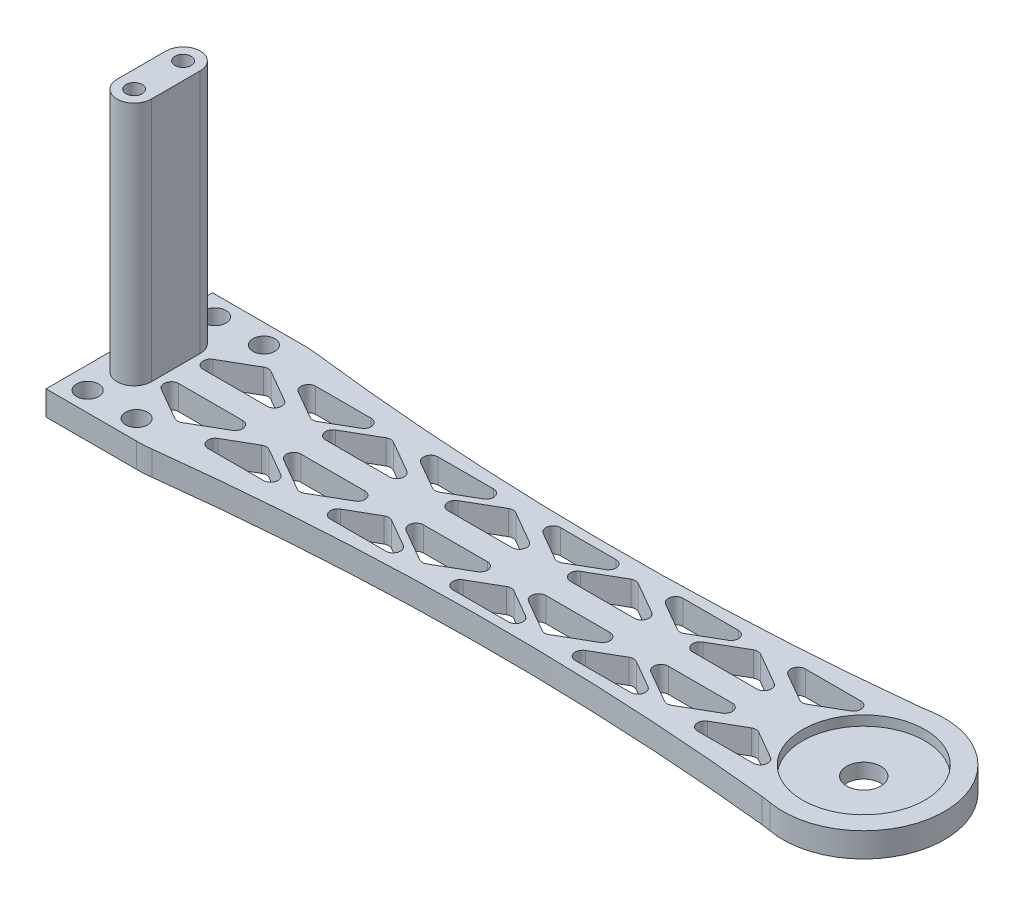
from build123d import *

# Parameters (mm, degrees)
EXTRUDE_1_DEPTH        = 2.5
SKETCH_2_R             = 12.5
CUT_EXTRUDE_1_DEPTH    = 2
SKETCH_3_R             = 3.5
CUT_EXTRUDE_2_DEPTH    = 168.392502819
CUT_EXTRUDE_3_DEPTH    = 168.440287864
CUT_EXTRUDE_4_DEPTH    = 168.440287864
SKETCH_6_R             = 2.25
CUT_EXTRUDE_5_DEPTH    = 168.440287864
FILLET_1_R             = 25
EXTRUDE_2_DEPTH        = 50
HOLE_WIZARD_M4_1_D     = 3.3
HOLE_WIZARD_M4_1_DEPTH = 11.5
HOLE_WIZARD_M4_1_TIP   = 0.991420021


with BuildPart() as part:
    # 草图1 → 凸台-拉伸1 (new, symmetric)
    with BuildSketch(Plane(origin=(0, 0, 0), x_dir=(1, 0, 0), z_dir=(0, 1, 0))):
        with BuildLine():
            Line((20, 17), (0, 17))
            Line((0, 17), (0, -17))
            Line((0, -17), (20, -17))
            ThreePointArc((20, -17), (83.152837536, -12.905656082), (146.357941984, -16.09302375))
            ThreePointArc((146.357941984, -16.09302375), (166.5, 0), (146.357941984, 16.09302375))
            ThreePointArc((146.357941984, 16.09302375), (83.152837536, 12.905656082), (20, 17))
        make_face()
    extrude(amount=EXTRUDE_1_DEPTH, both=True)

    # 草图2 → 切除-拉伸1 (cut)
    with BuildSketch(Plane(origin=(0, 2.5, 0), x_dir=(1, 0, 0), z_dir=(0, 1, 0))):
        with Locations((150, 0)):
            Circle(SKETCH_2_R)
    extrude(amount=-CUT_EXTRUDE_1_DEPTH, mode=Mode.SUBTRACT)

    # 草图3 → 切除-拉伸2 (cut, through all)
    with BuildSketch(Plane(origin=(0, 0.5, 0), x_dir=(1, 0, 0), z_dir=(0, 1, 0))):
        with Locations((150, 0)):
            Circle(SKETCH_3_R)
    extrude(amount=-CUT_EXTRUDE_2_DEPTH, mode=Mode.SUBTRACT)

    # 草图4 → 切除-拉伸3 (cut, through all)
    with BuildSketch(Plane(origin=(0, 2.5, 0), x_dir=(1, 0, 0), z_dir=(0, 1, 0))):
        with BuildLine():
            Line((12.598076211, 2.5), (25.650635095, 2.5))
            ThreePointArc((25.650635095, 2.5), (27.099523834, 3.611771432), (26.400635095, 5.299038106))
            Line((26.400635095, 5.299038106), (19.874355653, 9.066987298))
            ThreePointArc((19.874355653, 9.066987298), (19.124355653, 9.267949192), (18.374355653, 9.066987298))
            Line((18.374355653, 9.066987298), (11.848076211, 5.299038106))
            ThreePointArc((11.848076211, 5.299038106), (11.149187472, 3.611771432), (12.598076211, 2.5))
        make_face()
        with BuildLine():
            Line((37.598076211, 2.5), (50.650635095, 2.5))
            ThreePointArc((50.650635095, 2.5), (52.099523834, 3.611771432), (51.400635095, 5.299038106))
            Line((51.400635095, 5.299038106), (44.874355653, 9.066987298))
            ThreePointArc((44.874355653, 9.066987298), (44.124355653, 9.267949192), (43.374355653, 9.066987298))
            Line((43.374355653, 9.066987298), (36.848076211, 5.299038106))
            ThreePointArc((36.848076211, 5.299038106), (36.149187472, 3.611771432), (37.598076211, 2.5))
        make_face()
        with BuildLine():
            Line((62.598076211, 2.5), (75.650635095, 2.5))
            ThreePointArc((75.650635095, 2.5), (77.099523834, 3.611771432), (76.400635095, 5.299038106))
            Line((76.400635095, 5.299038106), (69.874355653, 9.066987298))
            ThreePointArc((69.874355653, 9.066987298), (69.124355653, 9.267949192), (68.374355653, 9.066987298))
            Line((68.374355653, 9.066987298), (61.848076211, 5.299038106))
            ThreePointArc((61.848076211, 5.299038106), (61.149187472, 3.611771432), (62.598076211, 2.5))
        make_face()
        with BuildLine():
            Line((87.598076211, 2.5), (100.650635095, 2.5))
            ThreePointArc((100.650635095, 2.5), (102.099523834, 3.611771432), (101.400635095, 5.299038106))
            Line((101.400635095, 5.299038106), (94.874355653, 9.066987298))
            ThreePointArc((94.874355653, 9.066987298), (94.124355653, 9.267949192), (93.374355653, 9.066987298))
            Line((93.374355653, 9.066987298), (86.848076211, 5.299038106))
            ThreePointArc((86.848076211, 5.299038106), (86.149187472, 3.611771432), (87.598076211, 2.5))
        make_face()
        with BuildLine():
            Line((112.598076211, 2.5), (125.650635095, 2.5))
            ThreePointArc((125.650635095, 2.5), (127.099523834, 3.611771432), (126.400635095, 5.299038106))
            Line((126.400635095, 5.299038106), (119.874355653, 9.066987298))
            ThreePointArc((119.874355653, 9.066987298), (119.124355653, 9.267949192), (118.374355653, 9.066987298))
            Line((118.374355653, 9.066987298), (111.848076211, 5.299038106))
            ThreePointArc((111.848076211, 5.299038106), (111.149187472, 3.611771432), (112.598076211, 2.5))
        make_face()
        with BuildLine():
            Line((118.374355653, -9.066987298), (111.848076211, -5.299038106))
            ThreePointArc((111.848076211, -5.299038106), (111.149187472, -3.611771432), (112.598076211, -2.5))
            Line((112.598076211, -2.5), (125.650635095, -2.5))
            ThreePointArc((125.650635095, -2.5), (127.099523834, -3.611771432), (126.400635095, -5.299038106))
            Line((126.400635095, -5.299038106), (119.874355653, -9.066987298))
            ThreePointArc((119.874355653, -9.066987298), (119.124355653, -9.267949192), (118.374355653, -9.066987298))
        make_face()
        with BuildLine():
            Line((93.374355653, -9.066987298), (86.848076211, -5.299038106))
            ThreePointArc((86.848076211, -5.299038106), (86.149187472, -3.611771432), (87.598076211, -2.5))
            Line((87.598076211, -2.5), (100.650635095, -2.5))
            ThreePointArc((100.650635095, -2.5), (102.099523834, -3.611771432), (101.400635095, -5.299038106))
            Line((101.400635095, -5.299038106), (94.874355653, -9.066987298))
            ThreePointArc((94.874355653, -9.066987298), (94.124355653, -9.267949192), (93.374355653, -9.066987298))
        make_face()
        with BuildLine():
            Line((68.374355653, -9.066987298), (61.848076211, -5.299038106))
            ThreePointArc((61.848076211, -5.299038106), (61.149187472, -3.611771432), (62.598076211, -2.5))
            Line((62.598076211, -2.5), (75.650635095, -2.5))
            ThreePointArc((75.650635095, -2.5), (77.099523834, -3.611771432), (76.400635095, -5.299038106))
            Line((76.400635095, -5.299038106), (69.874355653, -9.066987298))
            ThreePointArc((69.874355653, -9.066987298), (69.124355653, -9.267949192), (68.374355653, -9.066987298))
        make_face()
        with BuildLine():
            Line((43.374355653, -9.066987298), (36.848076211, -5.299038106))
            ThreePointArc((36.848076211, -5.299038106), (36.149187472, -3.611771432), (37.598076211, -2.5))
            Line((37.598076211, -2.5), (50.650635095, -2.5))
            ThreePointArc((50.650635095, -2.5), (52.099523834, -3.611771432), (51.400635095, -5.299038106))
            Line((51.400635095, -5.299038106), (44.874355653, -9.066987298))
            ThreePointArc((44.874355653, -9.066987298), (44.124355653, -9.267949192), (43.374355653, -9.066987298))
        make_face()
        with BuildLine():
            Line((18.374355653, -9.066987298), (11.848076211, -5.299038106))
            ThreePointArc((11.848076211, -5.299038106), (11.149187472, -3.611771432), (12.598076211, -2.5))
            Line((12.598076211, -2.5), (25.650635095, -2.5))
            ThreePointArc((25.650635095, -2.5), (27.099523834, -3.611771432), (26.400635095, -5.299038106))
            Line((26.400635095, -5.299038106), (19.874355653, -9.066987298))
            ThreePointArc((19.874355653, -9.066987298), (19.124355653, -9.267949192), (18.374355653, -9.066987298))
        make_face()
    extrude(amount=-CUT_EXTRUDE_3_DEPTH, mode=Mode.SUBTRACT)

    # 草图5 → 切除-拉伸4 (cut, through all)
    with BuildSketch(Plane(origin=(0, 2.5, 0), x_dir=(1, 0, 0), z_dir=(0, 1, 0))):
        with BuildLine():
            Line((127.081415713, 11), (138.401923789, 11))
            ThreePointArc((138.401923789, 11), (139.850812528, 9.888228568), (139.151923789, 8.200961894))
            Line((139.151923789, 8.200961894), (133.491669751, 4.933012702))
            ThreePointArc((133.491669751, 4.933012702), (132.741669751, 4.732050808), (131.991669751, 4.933012702))
            Line((131.991669751, 4.933012702), (126.331415713, 8.200961894))
            ThreePointArc((126.331415713, 8.200961894), (125.632526974, 9.888228568), (127.081415713, 11))
        make_face()
        with BuildLine():
            Line((102.081415713, 11), (113.401923789, 11))
            ThreePointArc((113.401923789, 11), (114.850812528, 9.888228568), (114.151923789, 8.200961894))
            Line((114.151923789, 8.200961894), (108.491669751, 4.933012702))
            ThreePointArc((108.491669751, 4.933012702), (107.741669751, 4.732050808), (106.991669751, 4.933012702))
            Line((106.991669751, 4.933012702), (101.331415713, 8.200961894))
            ThreePointArc((101.331415713, 8.200961894), (100.632526974, 9.888228568), (102.081415713, 11))
        make_face()
        with BuildLine():
            Line((77.081415713, 11), (88.401923789, 11))
            ThreePointArc((88.401923789, 11), (89.850812528, 9.888228568), (89.151923789, 8.200961894))
            Line((89.151923789, 8.200961894), (83.491669751, 4.933012702))
            ThreePointArc((83.491669751, 4.933012702), (82.741669751, 4.732050808), (81.991669751, 4.933012702))
            Line((81.991669751, 4.933012702), (76.331415713, 8.200961894))
            ThreePointArc((76.331415713, 8.200961894), (75.632526974, 9.888228568), (77.081415713, 11))
        make_face()
        with BuildLine():
            Line((52.081415713, 11), (63.401923789, 11))
            ThreePointArc((63.401923789, 11), (64.850812528, 9.888228568), (64.151923789, 8.200961894))
            Line((64.151923789, 8.200961894), (58.491669751, 4.933012702))
            ThreePointArc((58.491669751, 4.933012702), (57.741669751, 4.732050808), (56.991669751, 4.933012702))
            Line((56.991669751, 4.933012702), (51.331415713, 8.200961894))
            ThreePointArc((51.331415713, 8.200961894), (50.632526974, 9.888228568), (52.081415713, 11))
        make_face()
        with BuildLine():
            Line((27.081415713, 11), (38.401923789, 11))
            ThreePointArc((38.401923789, 11), (39.850812528, 9.888228568), (39.151923789, 8.200961894))
            Line((39.151923789, 8.200961894), (33.491669751, 4.933012702))
            ThreePointArc((33.491669751, 4.933012702), (32.741669751, 4.732050808), (31.991669751, 4.933012702))
            Line((31.991669751, 4.933012702), (26.331415713, 8.200961894))
            ThreePointArc((26.331415713, 8.200961894), (25.632526974, 9.888228568), (27.081415713, 11))
        make_face()
        with BuildLine():
            Line((31.991669751, -4.933012702), (26.331415713, -8.200961894))
            ThreePointArc((26.331415713, -8.200961894), (25.632526974, -9.888228568), (27.081415713, -11))
            Line((27.081415713, -11), (38.401923789, -11))
            ThreePointArc((38.401923789, -11), (39.850812528, -9.888228568), (39.151923789, -8.200961894))
            Line((39.151923789, -8.200961894), (33.491669751, -4.933012702))
            ThreePointArc((33.491669751, -4.933012702), (32.741669751, -4.732050808), (31.991669751, -4.933012702))
        make_face()
        with BuildLine():
            Line((56.991669751, -4.933012702), (51.331415713, -8.200961894))
            ThreePointArc((51.331415713, -8.200961894), (50.632526974, -9.888228568), (52.081415713, -11))
            Line((52.081415713, -11), (63.401923789, -11))
            ThreePointArc((63.401923789, -11), (64.850812528, -9.888228568), (64.151923789, -8.200961894))
            Line((64.151923789, -8.200961894), (58.491669751, -4.933012702))
            ThreePointArc((58.491669751, -4.933012702), (57.741669751, -4.732050808), (56.991669751, -4.933012702))
        make_face()
        with BuildLine():
            Line((81.991669751, -4.933012702), (76.331415713, -8.200961894))
            ThreePointArc((76.331415713, -8.200961894), (75.632526974, -9.888228568), (77.081415713, -11))
            Line((77.081415713, -11), (88.401923789, -11))
            ThreePointArc((88.401923789, -11), (89.850812528, -9.888228568), (89.151923789, -8.200961894))
            Line((89.151923789, -8.200961894), (83.491669751, -4.933012702))
            ThreePointArc((83.491669751, -4.933012702), (82.741669751, -4.732050808), (81.991669751, -4.933012702))
        make_face()
        with BuildLine():
            Line((106.991669751, -4.933012702), (101.331415713, -8.200961894))
            ThreePointArc((101.331415713, -8.200961894), (100.632526974, -9.888228568), (102.081415713, -11))
            Line((102.081415713, -11), (113.401923789, -11))
            ThreePointArc((113.401923789, -11), (114.850812528, -9.888228568), (114.151923789, -8.200961894))
            Line((114.151923789, -8.200961894), (108.491669751, -4.933012702))
            ThreePointArc((108.491669751, -4.933012702), (107.741669751, -4.732050808), (106.991669751, -4.933012702))
        make_face()
        with BuildLine():
            Line((131.991669751, -4.933012702), (126.331415713, -8.200961894))
            ThreePointArc((126.331415713, -8.200961894), (125.632526974, -9.888228568), (127.081415713, -11))
            Line((127.081415713, -11), (138.401923789, -11))
            ThreePointArc((138.401923789, -11), (139.850812528, -9.888228568), (139.151923789, -8.200961894))
            Line((139.151923789, -8.200961894), (133.491669751, -4.933012702))
            ThreePointArc((133.491669751, -4.933012702), (132.741669751, -4.732050808), (131.991669751, -4.933012702))
        make_face()
    extrude(amount=-CUT_EXTRUDE_4_DEPTH, mode=Mode.SUBTRACT)

    # 草图6 → 切除-拉伸5 (cut, through all)
    with BuildSketch(Plane(origin=(0, 2.5, 0), x_dir=(1, 0, 0), z_dir=(0, 1, 0))):
        with Locations((4.5, 13)):
            Circle(SKETCH_6_R)
        with Locations((14.5, 13)):
            Circle(SKETCH_6_R)
    cut_extrude_5 = extrude(amount=-CUT_EXTRUDE_5_DEPTH, mode=Mode.SUBTRACT)

    # 镜向1: 切除-拉伸5 across plane
    add(cut_extrude_5.mirror(Plane.XY), mode=Mode.SUBTRACT)

    # 圆角1
    fillet_1_edges = [part.edges().sort_by_distance(p)[0] for p in [
        (20, 0, 17),
        (146.357941984, 0, 16.09302375),
        (146.357941984, 0, -16.09302375),
        (20, 0, -17),
    ]]
    fillet(fillet_1_edges, radius=FILLET_1_R)

    # 草图8 → 凸台-拉伸2 (add)
    with BuildSketch(Plane(origin=(0, 2.5, 0), x_dir=(1, 0, 0), z_dir=(0, 1, 0))):
        with BuildLine():
            Line((9.5, 5), (9.5, -5))
            ThreePointArc((9.5, -5), (6, -8.5), (2.5, -5))
            Line((2.5, -5), (2.5, 5))
            ThreePointArc((2.5, 5), (6, 8.5), (9.5, 5))
        make_face()
    extrude(amount=EXTRUDE_2_DEPTH)

    # M4 螺纹孔1
    with Locations(Plane(origin=(6, 52.5, -5), x_dir=(0, 0, 1), z_dir=(0, 1, 0))):
        with Locations((0, 0), (10, 0)):
            Hole(HOLE_WIZARD_M4_1_D / 2, depth=HOLE_WIZARD_M4_1_DEPTH)
            with Locations((0, 0, -(HOLE_WIZARD_M4_1_DEPTH + HOLE_WIZARD_M4_1_TIP / 2))):  # 118° drill point
                Cone(0, HOLE_WIZARD_M4_1_D / 2, HOLE_WIZARD_M4_1_TIP, mode=Mode.SUBTRACT)


solid = part.part
